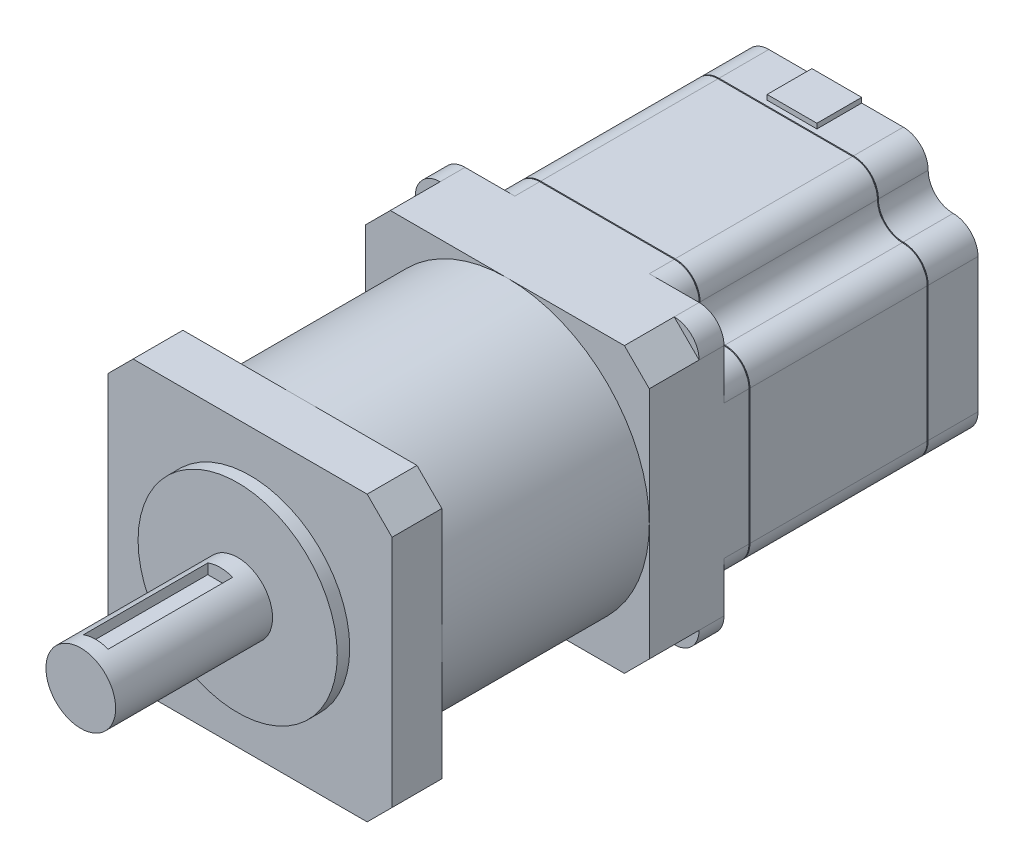
from build123d import *

# Parameters (mm, degrees)
CUT_EXTRUDE1_START       = -78.6
CUT_EXTRUDE1_DEPTH       = 56
CUT_EXTRUDE1_START_2     = -22.6
CUT_EXTRUDE1_2_OUTLINE_R = 19
CUT_EXTRUDE1_2_DEPTH     = 1.6
CUT_EXTRUDE1_START_3     = -27.6
CUT_EXTRUDE1_3_OUTLINE_R = 2.55
CUT_EXTRUDE1_3_DEPTH     = 5
CUT_EXTRUDE1_START_4     = -68.4
CUT_EXTRUDE1_4_DEPTH     = 35.6
CUT_EXTRUDE1_5_DEPTH     = 9
CUT_EXTRUDE1_START_5     = -32.6
CUT_EXTRUDE1_6_DEPTH     = 5
CUT_EXTRUDE1_START_6     = -69.6
CUT_EXTRUDE1_7_DEPTH     = 1
CUT_EXTRUDE2_START       = -1.6
SKETCH2_R                = 19
CUT_EXTRUDE2_DEPTH       = 1.6
BOSS_EXTRUDE1_DEPTH      = 10
SKETCH5_R                = 28.5
BOSS_EXTRUDE2_DEPTH      = 41.65
BOSS_EXTRUDE3_DEPTH      = 10
SKETCH7_R                = 20
BOSS_EXTRUDE4_DEPTH      = 2.5
SKETCH8_R                = 7
BOSS_EXTRUDE5_DEPTH      = 31.5
SKETCH9_W                = 5
SKETCH9_H                = 5
CUT_EXTRUDE3_DEPTH       = 25


with BuildPart() as part:
    # Cut-Extrude1: read off the stored shape, not the designer's step
    # Cut-Extrude1 outline → Cut-Extrude1 (new body)
    with BuildSketch(Plane.XY.offset(78.6).offset(CUT_EXTRUDE1_START)):
        with BuildLine():
            ThreePointArc((28.3, 13.5), (26.89411255, 16.89411255), (23.5, 18.3))
            ThreePointArc((23.5, 18.3), (19.823044738, 19.823044738), (18.3, 23.5))
            ThreePointArc((18.3, 23.5), (16.89411255, 26.89411255), (13.5, 28.3))
            Line((13.5, 28.3), (-13.5, 28.3))
            ThreePointArc((-13.5, 28.3), (-16.89411255, 26.89411255), (-18.3, 23.5))
            ThreePointArc((-18.3, 23.5), (-19.823044738, 19.823044738), (-23.5, 18.3))
            ThreePointArc((-23.5, 18.3), (-26.89411255, 16.89411255), (-28.3, 13.5))
            Line((-28.3, 13.5), (-28.3, -13.5))
            ThreePointArc((-28.3, -13.5), (-26.89411255, -16.89411255), (-23.5, -18.3))
            ThreePointArc((-23.5, -18.3), (-19.823044738, -19.823044738), (-18.3, -23.5))
            ThreePointArc((-18.3, -23.5), (-16.89411255, -26.89411255), (-13.5, -28.3))
            Line((-13.5, -28.3), (13.5, -28.3))
            ThreePointArc((13.5, -28.3), (16.89411255, -26.89411255), (18.3, -23.5))
            ThreePointArc((18.3, -23.5), (19.823044738, -19.823044738), (23.5, -18.3))
            ThreePointArc((23.5, -18.3), (26.89411255, -16.89411255), (28.3, -13.5))
            Line((28.3, -13.5), (28.3, 13.5))
        make_face()
    extrude(amount=CUT_EXTRUDE1_DEPTH)

    # Cut-Extrude1 2 outline → Cut-Extrude1 2 (add)
    with BuildSketch(Plane.XY.offset(78.6).offset(CUT_EXTRUDE1_START_2)):
        Circle(CUT_EXTRUDE1_2_OUTLINE_R)
    extrude(amount=CUT_EXTRUDE1_2_DEPTH)

    # Cut-Extrude1 3 outline → Cut-Extrude1 3 (add)
    with BuildSketch(Plane.XY.offset(78.6).offset(CUT_EXTRUDE1_START_3)):
        with BuildLine():
            Line((-28.5, 23.5), (-28.5, -23.5))
            ThreePointArc((-28.5, -23.5), (-27.035533906, -27.035533906), (-23.5, -28.5))
            Line((-23.5, -28.5), (23.5, -28.5))
            ThreePointArc((23.5, -28.5), (27.035533906, -27.035533906), (28.5, -23.5))
            Line((28.5, -23.5), (28.5, 23.5))
            ThreePointArc((28.5, 23.5), (27.035533906, 27.035533906), (23.5, 28.5))
            Line((23.5, 28.5), (-23.5, 28.5))
            ThreePointArc((-23.5, 28.5), (-27.035533906, 27.035533906), (-28.5, 23.5))
        make_face()
        with Locations((-23.5, 23.5)):
            Circle(CUT_EXTRUDE1_3_OUTLINE_R, mode=Mode.SUBTRACT)
        with BuildLine():
            ThreePointArc((28.3, -13.5), (26.89411255, -16.89411255), (23.5, -18.3))
            ThreePointArc((23.5, -18.3), (19.823044738, -19.823044738), (18.3, -23.5))
            ThreePointArc((18.3, -23.5), (16.89411255, -26.89411255), (13.5, -28.3))
            Line((13.5, -28.3), (-13.5, -28.3))
            ThreePointArc((-13.5, -28.3), (-16.89411255, -26.89411255), (-18.3, -23.5))
            ThreePointArc((-18.3, -23.5), (-19.823044738, -19.823044738), (-23.5, -18.3))
            ThreePointArc((-23.5, -18.3), (-26.89411255, -16.89411255), (-28.3, -13.5))
            Line((-28.3, -13.5), (-28.3, 13.5))
            ThreePointArc((-28.3, 13.5), (-26.89411255, 16.89411255), (-23.5, 18.3))
            ThreePointArc((-23.5, 18.3), (-19.823044738, 19.823044738), (-18.3, 23.5))
            ThreePointArc((-18.3, 23.5), (-16.89411255, 26.89411255), (-13.5, 28.3))
            Line((-13.5, 28.3), (13.5, 28.3))
            ThreePointArc((13.5, 28.3), (16.89411255, 26.89411255), (18.3, 23.5))
            ThreePointArc((18.3, 23.5), (19.823044738, 19.823044738), (23.5, 18.3))
            ThreePointArc((23.5, 18.3), (26.89411255, 16.89411255), (28.3, 13.5))
            Line((28.3, 13.5), (28.3, -13.5))
        make_face(mode=Mode.SUBTRACT)
        with Locations((23.5, 23.5)):
            Circle(CUT_EXTRUDE1_3_OUTLINE_R, mode=Mode.SUBTRACT)
        with Locations((23.5, -23.5)):
            Circle(CUT_EXTRUDE1_3_OUTLINE_R, mode=Mode.SUBTRACT)
        with Locations((-23.5, -23.5)):
            Circle(CUT_EXTRUDE1_3_OUTLINE_R, mode=Mode.SUBTRACT)
    extrude(amount=CUT_EXTRUDE1_3_DEPTH)

    # Cut-Extrude1 4 outline → Cut-Extrude1 4 (add)
    with BuildSketch(Plane.XY.offset(78.6).offset(CUT_EXTRUDE1_START_4)):
        with BuildLine():
            ThreePointArc((-23.5, 18.5), (-27.035533906, 17.035533906), (-28.5, 13.5))
            Line((-28.5, 13.5), (-28.5, -13.5))
            ThreePointArc((-28.5, -13.5), (-27.035533906, -17.035533906), (-23.5, -18.5))
            ThreePointArc((-23.5, -18.5), (-19.964466094, -19.964466094), (-18.5, -23.5))
            ThreePointArc((-18.5, -23.5), (-17.035533906, -27.035533906), (-13.5, -28.5))
            Line((-13.5, -28.5), (13.5, -28.5))
            ThreePointArc((13.5, -28.5), (17.035533906, -27.035533906), (18.5, -23.5))
            ThreePointArc((18.5, -23.5), (19.964466094, -19.964466094), (23.5, -18.5))
            ThreePointArc((23.5, -18.5), (27.035533906, -17.035533906), (28.5, -13.5))
            Line((28.5, -13.5), (28.5, 13.5))
            ThreePointArc((28.5, 13.5), (27.035533906, 17.035533906), (23.5, 18.5))
            ThreePointArc((23.5, 18.5), (19.964466094, 19.964466094), (18.5, 23.5))
            ThreePointArc((18.5, 23.5), (17.035533906, 27.035533906), (13.5, 28.5))
            Line((13.5, 28.5), (-13.5, 28.5))
            ThreePointArc((-13.5, 28.5), (-17.035533906, 27.035533906), (-18.5, 23.5))
            ThreePointArc((-18.5, 23.5), (-19.964466094, 19.964466094), (-23.5, 18.5))
        make_face()
        with BuildLine():
            ThreePointArc((18.3, 23.5), (19.823044738, 19.823044738), (23.5, 18.3))
            ThreePointArc((23.5, 18.3), (26.89411255, 16.89411255), (28.3, 13.5))
            Line((28.3, 13.5), (28.3, -13.5))
            ThreePointArc((28.3, -13.5), (26.89411255, -16.89411255), (23.5, -18.3))
            ThreePointArc((23.5, -18.3), (19.823044738, -19.823044738), (18.3, -23.5))
            ThreePointArc((18.3, -23.5), (16.89411255, -26.89411255), (13.5, -28.3))
            Line((13.5, -28.3), (-13.5, -28.3))
            ThreePointArc((-13.5, -28.3), (-16.89411255, -26.89411255), (-18.3, -23.5))
            ThreePointArc((-18.3, -23.5), (-19.823044738, -19.823044738), (-23.5, -18.3))
            ThreePointArc((-23.5, -18.3), (-26.89411255, -16.89411255), (-28.3, -13.5))
            Line((-28.3, -13.5), (-28.3, 13.5))
            ThreePointArc((-28.3, 13.5), (-26.89411255, 16.89411255), (-23.5, 18.3))
            ThreePointArc((-23.5, 18.3), (-19.823044738, 19.823044738), (-18.3, 23.5))
            ThreePointArc((-18.3, 23.5), (-16.89411255, 26.89411255), (-13.5, 28.3))
            Line((-13.5, 28.3), (13.5, 28.3))
            ThreePointArc((13.5, 28.3), (16.89411255, 26.89411255), (18.3, 23.5))
        make_face(mode=Mode.SUBTRACT)
    extrude(amount=CUT_EXTRUDE1_4_DEPTH)

    # Cut-Extrude1 5 outline → Cut-Extrude1 5 (add)
    with BuildSketch(Plane.XY.offset(78.6).offset(CUT_EXTRUDE1_START)):
        with BuildLine():
            ThreePointArc((-23.5, 18.5), (-27.035533906, 17.035533906), (-28.5, 13.5))
            Line((-28.5, 13.5), (-28.5, -13.5))
            ThreePointArc((-28.5, -13.5), (-27.035533906, -17.035533906), (-23.5, -18.5))
            ThreePointArc((-23.5, -18.5), (-19.964466094, -19.964466094), (-18.5, -23.5))
            ThreePointArc((-18.5, -23.5), (-17.035533906, -27.035533906), (-13.5, -28.5))
            Line((-13.5, -28.5), (13.5, -28.5))
            ThreePointArc((13.5, -28.5), (17.035533906, -27.035533906), (18.5, -23.5))
            ThreePointArc((18.5, -23.5), (19.964466094, -19.964466094), (23.5, -18.5))
            ThreePointArc((23.5, -18.5), (27.035533906, -17.035533906), (28.5, -13.5))
            Line((28.5, -13.5), (28.5, 13.5))
            ThreePointArc((28.5, 13.5), (27.035533906, 17.035533906), (23.5, 18.5))
            ThreePointArc((23.5, 18.5), (19.964466094, 19.964466094), (18.5, 23.5))
            ThreePointArc((18.5, 23.5), (17.035533906, 27.035533906), (13.5, 28.5))
            Line((13.5, 28.5), (5.151063198, 28.5))
            Line((5.151063198, 28.5), (5.151063198, 29.5))
            Line((5.151063198, 29.5), (-4.848936802, 29.5))
            Line((-4.848936802, 29.5), (-4.848936802, 28.5))
            Line((-4.848936802, 28.5), (-13.5, 28.5))
            ThreePointArc((-13.5, 28.5), (-17.035533906, 27.035533906), (-18.5, 23.5))
            ThreePointArc((-18.5, 23.5), (-19.964466094, 19.964466094), (-23.5, 18.5))
        make_face()
        with BuildLine():
            ThreePointArc((18.3, 23.5), (19.823044738, 19.823044738), (23.5, 18.3))
            ThreePointArc((23.5, 18.3), (26.89411255, 16.89411255), (28.3, 13.5))
            Line((28.3, 13.5), (28.3, -13.5))
            ThreePointArc((28.3, -13.5), (26.89411255, -16.89411255), (23.5, -18.3))
            ThreePointArc((23.5, -18.3), (19.823044738, -19.823044738), (18.3, -23.5))
            ThreePointArc((18.3, -23.5), (16.89411255, -26.89411255), (13.5, -28.3))
            Line((13.5, -28.3), (-13.5, -28.3))
            ThreePointArc((-13.5, -28.3), (-16.89411255, -26.89411255), (-18.3, -23.5))
            ThreePointArc((-18.3, -23.5), (-19.823044738, -19.823044738), (-23.5, -18.3))
            ThreePointArc((-23.5, -18.3), (-26.89411255, -16.89411255), (-28.3, -13.5))
            Line((-28.3, -13.5), (-28.3, 13.5))
            ThreePointArc((-28.3, 13.5), (-26.89411255, 16.89411255), (-23.5, 18.3))
            ThreePointArc((-23.5, 18.3), (-19.823044738, 19.823044738), (-18.3, 23.5))
            ThreePointArc((-18.3, 23.5), (-16.89411255, 26.89411255), (-13.5, 28.3))
            Line((-13.5, 28.3), (13.5, 28.3))
            ThreePointArc((13.5, 28.3), (16.89411255, 26.89411255), (18.3, 23.5))
        make_face(mode=Mode.SUBTRACT)
    extrude(amount=CUT_EXTRUDE1_5_DEPTH)

    # Cut-Extrude1 6 outline → Cut-Extrude1 6 (add)
    with BuildSketch(Plane.XY.offset(78.6).offset(CUT_EXTRUDE1_START_5)):
        with BuildLine():
            ThreePointArc((-23.5, 18.5), (-27.035533906, 17.035533906), (-28.5, 13.5))
            Line((-28.5, 13.5), (-28.5, -13.5))
            ThreePointArc((-28.5, -13.5), (-27.035533906, -17.035533906), (-23.5, -18.5))
            ThreePointArc((-23.5, -18.5), (-19.964466094, -19.964466094), (-18.5, -23.5))
            ThreePointArc((-18.5, -23.5), (-17.035533906, -27.035533906), (-13.5, -28.5))
            Line((-13.5, -28.5), (13.5, -28.5))
            ThreePointArc((13.5, -28.5), (17.035533906, -27.035533906), (18.5, -23.5))
            ThreePointArc((18.5, -23.5), (19.964466094, -19.964466094), (23.5, -18.5))
            ThreePointArc((23.5, -18.5), (27.035533906, -17.035533906), (28.5, -13.5))
            Line((28.5, -13.5), (28.5, 13.5))
            ThreePointArc((28.5, 13.5), (27.035533906, 17.035533906), (23.5, 18.5))
            ThreePointArc((23.5, 18.5), (19.964466094, 19.964466094), (18.5, 23.5))
            ThreePointArc((18.5, 23.5), (17.035533906, 27.035533906), (13.5, 28.5))
            Line((13.5, 28.5), (-13.5, 28.5))
            ThreePointArc((-13.5, 28.5), (-17.035533906, 27.035533906), (-18.5, 23.5))
            ThreePointArc((-18.5, 23.5), (-19.964466094, 19.964466094), (-23.5, 18.5))
        make_face()
        with BuildLine():
            ThreePointArc((18.3, 23.5), (19.823044738, 19.823044738), (23.5, 18.3))
            ThreePointArc((23.5, 18.3), (26.89411255, 16.89411255), (28.3, 13.5))
            Line((28.3, 13.5), (28.3, -13.5))
            ThreePointArc((28.3, -13.5), (26.89411255, -16.89411255), (23.5, -18.3))
            ThreePointArc((23.5, -18.3), (19.823044738, -19.823044738), (18.3, -23.5))
            ThreePointArc((18.3, -23.5), (16.89411255, -26.89411255), (13.5, -28.3))
            Line((13.5, -28.3), (-13.5, -28.3))
            ThreePointArc((-13.5, -28.3), (-16.89411255, -26.89411255), (-18.3, -23.5))
            ThreePointArc((-18.3, -23.5), (-19.823044738, -19.823044738), (-23.5, -18.3))
            ThreePointArc((-23.5, -18.3), (-26.89411255, -16.89411255), (-28.3, -13.5))
            Line((-28.3, -13.5), (-28.3, 13.5))
            ThreePointArc((-28.3, 13.5), (-26.89411255, 16.89411255), (-23.5, 18.3))
            ThreePointArc((-23.5, 18.3), (-19.823044738, 19.823044738), (-18.3, 23.5))
            ThreePointArc((-18.3, 23.5), (-16.89411255, 26.89411255), (-13.5, 28.3))
            Line((-13.5, 28.3), (13.5, 28.3))
            ThreePointArc((13.5, 28.3), (16.89411255, 26.89411255), (18.3, 23.5))
        make_face(mode=Mode.SUBTRACT)
    extrude(amount=CUT_EXTRUDE1_6_DEPTH)

    # Cut-Extrude1 7 outline → Cut-Extrude1 7 (add)
    with BuildSketch(Plane.XY.offset(78.6).offset(CUT_EXTRUDE1_START_6)):
        with BuildLine():
            ThreePointArc((-23.5, 18.5), (-27.035533906, 17.035533906), (-28.5, 13.5))
            Line((-28.5, 13.5), (-28.5, -13.5))
            ThreePointArc((-28.5, -13.5), (-27.035533906, -17.035533906), (-23.5, -18.5))
            ThreePointArc((-23.5, -18.5), (-19.964466094, -19.964466094), (-18.5, -23.5))
            ThreePointArc((-18.5, -23.5), (-17.035533906, -27.035533906), (-13.5, -28.5))
            Line((-13.5, -28.5), (13.5, -28.5))
            ThreePointArc((13.5, -28.5), (17.035533906, -27.035533906), (18.5, -23.5))
            ThreePointArc((18.5, -23.5), (19.964466094, -19.964466094), (23.5, -18.5))
            ThreePointArc((23.5, -18.5), (27.035533906, -17.035533906), (28.5, -13.5))
            Line((28.5, -13.5), (28.5, 13.5))
            ThreePointArc((28.5, 13.5), (27.035533906, 17.035533906), (23.5, 18.5))
            ThreePointArc((23.5, 18.5), (19.964466094, 19.964466094), (18.5, 23.5))
            ThreePointArc((18.5, 23.5), (17.035533906, 27.035533906), (13.5, 28.5))
            Line((13.5, 28.5), (-13.5, 28.5))
            ThreePointArc((-13.5, 28.5), (-17.035533906, 27.035533906), (-18.5, 23.5))
            ThreePointArc((-18.5, 23.5), (-19.964466094, 19.964466094), (-23.5, 18.5))
        make_face()
        with BuildLine():
            ThreePointArc((18.3, 23.5), (19.823044738, 19.823044738), (23.5, 18.3))
            ThreePointArc((23.5, 18.3), (26.89411255, 16.89411255), (28.3, 13.5))
            Line((28.3, 13.5), (28.3, -13.5))
            ThreePointArc((28.3, -13.5), (26.89411255, -16.89411255), (23.5, -18.3))
            ThreePointArc((23.5, -18.3), (19.823044738, -19.823044738), (18.3, -23.5))
            ThreePointArc((18.3, -23.5), (16.89411255, -26.89411255), (13.5, -28.3))
            Line((13.5, -28.3), (-13.5, -28.3))
            ThreePointArc((-13.5, -28.3), (-16.89411255, -26.89411255), (-18.3, -23.5))
            ThreePointArc((-18.3, -23.5), (-19.823044738, -19.823044738), (-23.5, -18.3))
            ThreePointArc((-23.5, -18.3), (-26.89411255, -16.89411255), (-28.3, -13.5))
            Line((-28.3, -13.5), (-28.3, 13.5))
            ThreePointArc((-28.3, 13.5), (-26.89411255, 16.89411255), (-23.5, 18.3))
            ThreePointArc((-23.5, 18.3), (-19.823044738, 19.823044738), (-18.3, 23.5))
            ThreePointArc((-18.3, 23.5), (-16.89411255, 26.89411255), (-13.5, 28.3))
            Line((-13.5, 28.3), (13.5, 28.3))
            ThreePointArc((13.5, 28.3), (16.89411255, 26.89411255), (18.3, 23.5))
        make_face(mode=Mode.SUBTRACT)
    extrude(amount=CUT_EXTRUDE1_7_DEPTH)

    # Sketch2 → Cut-Extrude2 (cut)
    with BuildSketch(Plane.XY.offset(57.6).offset(CUT_EXTRUDE2_START)):
        Circle(SKETCH2_R)
    extrude(amount=CUT_EXTRUDE2_DEPTH, mode=Mode.SUBTRACT)

    # Sketch4 → Boss-Extrude1 (add)
    with BuildSketch(Plane.XY.offset(56)):
        Polygon((-28.5, 23.5), (-28.5, -23.5), (-23.5, -28.5), (23.5, -28.5), (28.5, -23.5), (28.5, 23.5), (23.5, 28.5), (-23.5, 28.5), align=None)
    extrude(amount=BOSS_EXTRUDE1_DEPTH)

    # Sketch5 → Boss-Extrude2 (add)
    with BuildSketch(Plane.XY.offset(66)):
        Circle(SKETCH5_R)
    extrude(amount=BOSS_EXTRUDE2_DEPTH)

    # Sketch6 → Boss-Extrude3 (add)
    with BuildSketch(Plane.XY.offset(107.65)):
        Polygon((-28.5, 23.5), (-23.5, 28.5), (23.5, 28.5), (28.5, 23.5), (28.5, -23.5), (23.5, -28.5), (-23.5, -28.5), (-28.5, -23.5), align=None)
    extrude(amount=BOSS_EXTRUDE3_DEPTH)

    # Sketch7 → Boss-Extrude4 (add)
    with BuildSketch(Plane.XY.offset(117.65)):
        Circle(SKETCH7_R)
    extrude(amount=BOSS_EXTRUDE4_DEPTH)

    # Sketch8 → Boss-Extrude5 (add)
    with BuildSketch(Plane.XY.offset(120.15)):
        Circle(SKETCH8_R)
    extrude(amount=BOSS_EXTRUDE5_DEPTH)

    # Sketch9 → Cut-Extrude3 (cut)
    with BuildSketch(Plane.XY.offset(148.65)):
        with Locations((0, 7)):
            Rectangle(SKETCH9_W, SKETCH9_H)
    extrude(amount=-CUT_EXTRUDE3_DEPTH, mode=Mode.SUBTRACT)


solid = part.part
